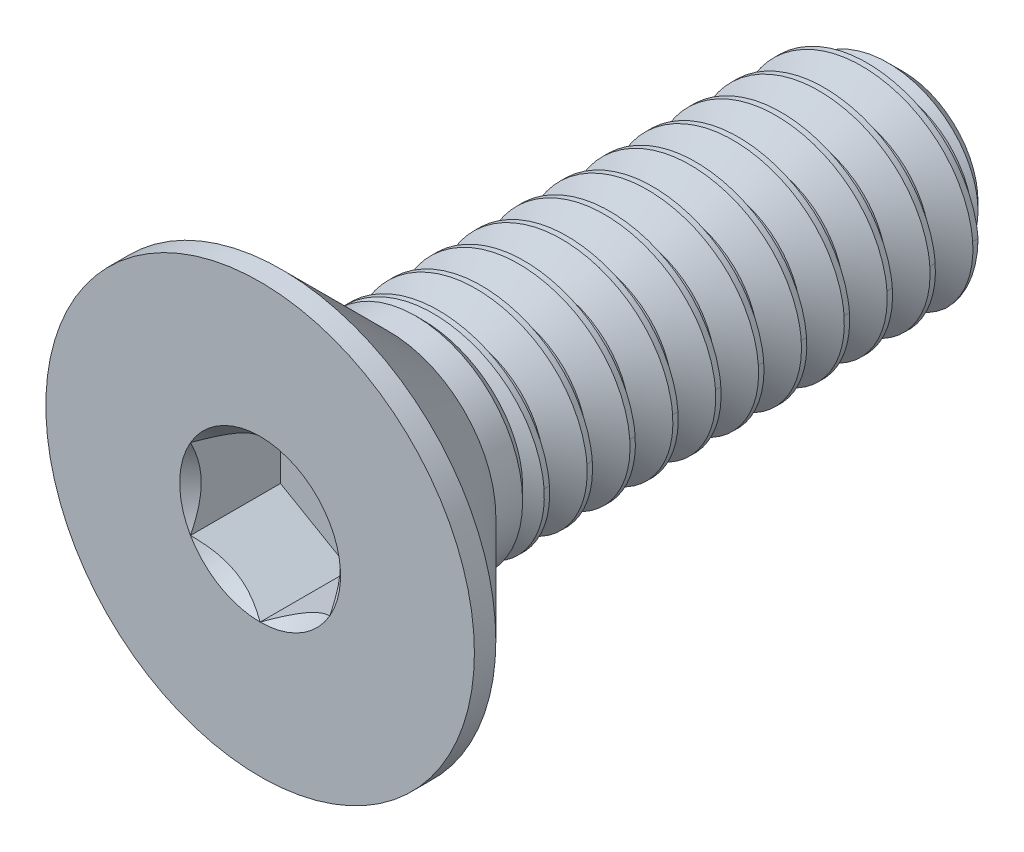
from build123d import *
from build123d.topology import SkipClean

# Parameters (mm, degrees)
SKETCH1_W          = 6
SKETCH1_H          = 1
CHAMFER1_SIZE      = 0.3
CUT_EXTRUDE2_DEPTH = 0.84
CUT_SWEEP1_PITCH   = 0.4


with BuildPart() as part:
    # Sketch1 → Revolve1 (revolve)
    with BuildSketch(Plane(origin=(0, 0, 0), x_dir=(0, 0, -1), z_dir=(1, 0, 0))):
        with Locations((3, 0.5)):
            Rectangle(SKETCH1_W, SKETCH1_H)
    revolve(axis=Axis((0, 0, -6), (0, 0, 1)))

    # Chamfer1
    chamfer1_edges = [part.edges().sort_by_distance(p)[0] for p in [
        (0, -1, -6),
    ]]
    chamfer(chamfer1_edges, length=CHAMFER1_SIZE)

    # Sketch7 → Revolve2 (revolve)
    with BuildSketch(Plane(origin=(0, 0, 0), x_dir=(0, 0, -1), z_dir=(1, 0, 0)), mode=Mode.PRIVATE) as revolve2_sk:
        Polygon((0, 2), (0.2, 2), (1.2, 1), (1.45, 1), (1.45, 0), (0, 0), align=None)
    revolve(revolve2_sk.sketch.rotate(Axis((0, 0, 0), (0, 0, -1)), 90), axis=Axis((0, 0, 0), (0, 0, -1)))

    # Sketch5 → Cut-Extrude2 (cut)
    with BuildSketch(Plane.XY):
        Polygon((0.65, -0.375277675), (0.65, 0.375277675), (0, 0.75055535), (-0.65, 0.375277675), (-0.65, -0.375277675), (0, -0.75055535), align=None)
    extrude(amount=-CUT_EXTRUDE2_DEPTH, mode=Mode.SUBTRACT)

    # Cut-Extrude3 cone 1 section (through the dimple's axis) → Cut-Extrude3 (revolve, cut)
    with BuildSketch(Plane(origin=(0, 0, 0), x_dir=(0, -1, 0), z_dir=(1, 0, 0))):
        Polygon((0, 0), (0.75055535, 0), (0, 0.75055535), align=None)
    revolve(axis=Axis((0, 0, 0), (0, 0, -1)), mode=Mode.SUBTRACT)

    # Cut-Sweep1: arcs per turn and ends read off the stored shape
    # Cut-Sweep1: the profile of Sketch2 screwed along a right-hand helix through 13 turns, 6 arcs to a turn; built about Z, then put on its axis
    cut_sweep1_z = Axis((0, 0, 0), (0, 0, 1))
    cut_sweep1_corners = [(1, 0, -0.35), (0.740192379, 0, -0.2), (0.740192379, 0, -0.15), (1, 0, 0), (1.01, 0, 0.005773503), (1.01, 0, -0.355773503)]
    with BuildLine(mode=Mode.PRIVATE) as cut_sweep1_profile:
        Line(cut_sweep1_corners[0], cut_sweep1_corners[1])
        Line(cut_sweep1_corners[1], cut_sweep1_corners[2])
        Line(cut_sweep1_corners[2], cut_sweep1_corners[3])
        Line(cut_sweep1_corners[3], cut_sweep1_corners[4])
        Line(cut_sweep1_corners[4], cut_sweep1_corners[5])
        Line(cut_sweep1_corners[5], cut_sweep1_corners[0])
    cut_sweep1_cap = Face(cut_sweep1_profile.wire())
    cut_sweep1_turn_angles = [0, 30, 60, 90, 120, 150, 180, 210, 240, 270, 300, 330, 360]
    cut_sweep1_turn_weights = [1, 0.8660254037844387, 1, 0.8660254037844387, 1, 0.8660254037844387, 1, 0.8660254037844387, 1, 0.8660254037844387, 1, 0.8660254037844387, 1]
    cut_sweep1_turn_rails = [Edge.make_bspline([Vector(p[0], p[1], 0).rotate(cut_sweep1_z, cut_sweep1_turn_angles[k]) / cut_sweep1_turn_weights[k] + Vector(0, 0, p[2] + CUT_SWEEP1_PITCH * cut_sweep1_turn_angles[k] / 360) for k in range(13)], [0, 0, 0, 1, 1, 2, 2, 3, 3, 4, 4, 5, 5, 6, 6, 6], 2, cut_sweep1_turn_weights) for p in cut_sweep1_corners]
    cut_sweep1_turn_sides = [Face.make_surface_from_curves(cut_sweep1_turn_rails[p[0]], cut_sweep1_turn_rails[p[1]]) for p in [(0, 1), (1, 2), (2, 3), (3, 4), (4, 5), (5, 0)]]
    cut_sweep1 = Plane(origin=(0, 0, -6), x_dir=(0, 1, 0), z_dir=(0, 0, 1)) * Solid(Shell([*[p.moved(Location((0, 0, CUT_SWEEP1_PITCH * i))) for i in range(13) for p in cut_sweep1_turn_sides], cut_sweep1_cap, cut_sweep1_cap.rotate(cut_sweep1_z, 4680).moved(Location((0, 0, CUT_SWEEP1_PITCH * 4680 / 360)))]))
    add(cut_sweep1, mode=Mode.SUBTRACT)

    # Sketch12 → Revolve3 (revolve)
    with SkipClean():  # the faces are left unmerged after this step: merging them gives an invalid solid
        with BuildSketch(Plane(origin=(0, 0, 0), x_dir=(0, 0, -1), z_dir=(1, 0, 0)), mode=Mode.PRIVATE) as revolve3_sk:
            Polygon((1.2, 1), (0.95, 1.25), (0.95, 0), (1.45, 0), (1.45, 1), align=None)
        revolve(revolve3_sk.sketch.rotate(Axis((0, 0, -6), (0, 0, -1)), 90), axis=Axis((0, 0, -6), (0, 0, -1)))


with BuildPart() as boss_extrude3_tool:
    # Boss-Extrude3: read off the stored shape, not the designer's step
    # Boss-Extrude3 outline → Boss-Extrude3 (revolve)
    with SkipClean():  # the faces are left unmerged after this step: merging them gives an invalid solid
        with BuildSketch(Plane.XZ):
            Polygon((0.740189523, -1.449994462), (0.740189523, -1.709810477), (1.000005538, -1.449994462), align=None)
        revolve(axis=Axis((0, 0, 0), (0, 0, 1)))


with BuildPart() as part_1:
    with SkipClean():  # the faces are left unmerged after this step: merging them gives an invalid solid
        add(part.part)


with BuildPart() as part_2:
    # Boss-Extrude3: joined with boss_extrude3_tool
    with SkipClean():  # the faces are left unmerged after this step: merging them gives an invalid solid
        add(part_1.part.fuse(boss_extrude3_tool.part, tol=0.00001))


solid = part_2.part
